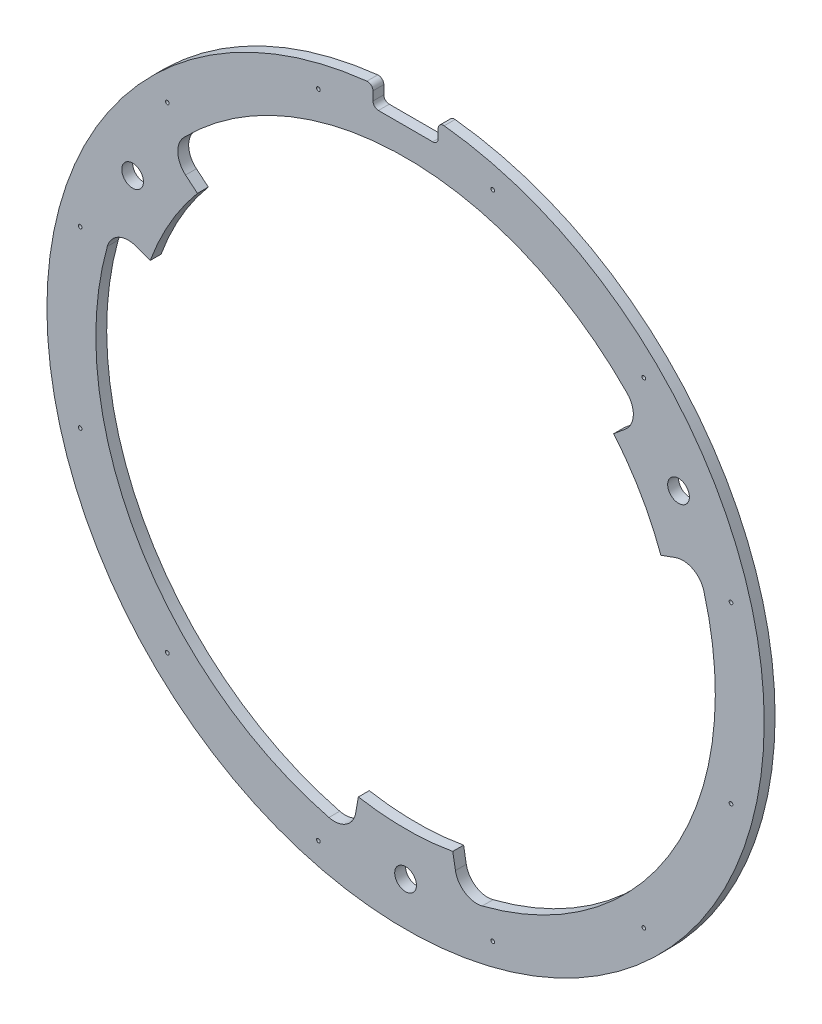
from build123d import *

# Parameters (mm, degrees)
SKETCH2_R                                       = 330
SKETCH2_R_2                                     = 250
BOSS_EXTRUDE1_DEPTH                             = 10
CUT_EXTRUDE1_START                              = -10
CUT_EXTRUDE1_DEPTH                              = 10
SKETCH4_R                                       = 10
CUT_EXTRUDE2_DEPTH                              = 10
SKETCH5_W                                       = 60
SKETCH5_H                                       = 60
CUT_EXTRUDE3_DEPTH                              = 10
FILLET1_R                                       = 5
CSK_FOR_M3_FLAT_HEAD_MACHINE_SCREW1_D           = 3.4
CSK_FOR_M3_FLAT_HEAD_MACHINE_SCREW1_CSINK_D     = 6.3
CSK_FOR_M3_FLAT_HEAD_MACHINE_SCREW1_CSINK_ANGLE = 90


with BuildPart() as part:
    # Sketch2 → Boss-Extrude1 (new body)
    with BuildSketch(Plane.XY):
        Circle(SKETCH2_R)
        Circle(SKETCH2_R_2, mode=Mode.SUBTRACT)
    extrude(amount=BOSS_EXTRUDE1_DEPTH)

    # Sketch3 → Cut-Extrude1 (cut)
    with BuildSketch(Plane.XY.offset(10).offset(CUT_EXTRUDE1_START)):
        with BuildLine():
            Line((191.51111078, 160.696902422), (202.422805046, 169.852901056))
            ThreePointArc((202.422805046, 169.852901056), (209.542560602, 184.184300077), (203.874000238, 199.14917029))
            ThreePointArc((203.874000238, 199.14917029), (0, 285), (-203.874000238, 199.14917029))
            ThreePointArc((-203.874000238, 199.14917029), (-209.542560602, 184.184300077), (-202.422805046, 169.852901056))
            Line((-202.422805046, 169.852901056), (-191.51111078, 160.696902422))
            ThreePointArc((-191.51111078, 160.696902422), (0, 250), (191.51111078, 160.696902422))
        make_face()
        with BuildLine():
            Line((43.412044417, -246.201938253), (45.885524698, -260.229742003))
            ThreePointArc((45.885524698, -260.229742003), (54.737002544, -273.561330694), (70.531240495, -276.134648522))
            ThreePointArc((70.531240495, -276.134648522), (246.817240079, -142.5), (274.405240732, 76.985478232))
            ThreePointArc((274.405240732, 76.985478232), (264.279563146, 89.377030617), (248.308329744, 90.376840947))
            Line((248.308329744, 90.376840947), (234.923155196, 85.505035831))
            ThreePointArc((234.923155196, 85.505035831), (216.506350946, -125), (43.412044417, -246.201938253))
        make_face()
        with BuildLine():
            Line((-234.923155196, 85.505035831), (-248.308329744, 90.376840947))
            ThreePointArc((-248.308329744, 90.376840947), (-264.279563146, 89.377030617), (-274.405240732, 76.985478232))
            ThreePointArc((-274.405240732, 76.985478232), (-246.817240079, -142.5), (-70.531240495, -276.134648522))
            ThreePointArc((-70.531240495, -276.134648522), (-54.737002544, -273.561330694), (-45.885524698, -260.229742003))
            Line((-45.885524698, -260.229742003), (-43.412044417, -246.201938253))
            ThreePointArc((-43.412044417, -246.201938253), (-216.506350946, -125), (-234.923155196, 85.505035831))
        make_face()
    extrude(amount=CUT_EXTRUDE1_DEPTH, mode=Mode.SUBTRACT)

    # Sketch4 → Cut-Extrude2 (cut)
    with BuildSketch(Plane.XY.offset(10)):
        with Locations((0, -290)):
            Circle(SKETCH4_R)
        with Locations((-251.147367097, 145)):
            Circle(SKETCH4_R)
        with Locations((251.147367097, 145)):
            Circle(SKETCH4_R)
    extrude(amount=-CUT_EXTRUDE2_DEPTH, mode=Mode.SUBTRACT)

    # Sketch5 → Cut-Extrude3 (cut)
    with BuildSketch(Plane.XY.offset(10)):
        with Locations((0, 340)):
            Rectangle(SKETCH5_W, SKETCH5_H)
    extrude(amount=-CUT_EXTRUDE3_DEPTH, mode=Mode.SUBTRACT)

    # Fillet1
    fillet1_edges = [part.edges().sort_by_distance(p)[0] for p in [
        (30, 328.633534503, 5),
        (-30, 328.633534503, 5),
        (30, 310, 5),
        (-30, 310, 5),
    ]]
    fillet(fillet1_edges, radius=FILLET1_R)

    # CSK for M3 Flat Head Machine Screw1 (through all)
    with Locations(Plane(origin=(0, 0, -20), x_dir=(1, 0, 0), z_dir=(0, 0, -1))):
        with Locations((80.233903982, 299.43700615), (219.203102168, 219.203102168), (299.43700615, 80.233903982), (299.43700615, -80.233903982), (219.203102168, -219.203102168), (80.233903982, -299.43700615), (-80.233903982, -299.43700615), (-219.203102168, -219.203102168), (-299.43700615, -80.233903982), (-299.43700615, 80.233903982), (-219.203102168, 219.203102168), (-80.233903982, 299.43700615), (0, 0)):
            CounterSinkHole(CSK_FOR_M3_FLAT_HEAD_MACHINE_SCREW1_D / 2, CSK_FOR_M3_FLAT_HEAD_MACHINE_SCREW1_CSINK_D / 2, counter_sink_angle=CSK_FOR_M3_FLAT_HEAD_MACHINE_SCREW1_CSINK_ANGLE)


solid = part.part
